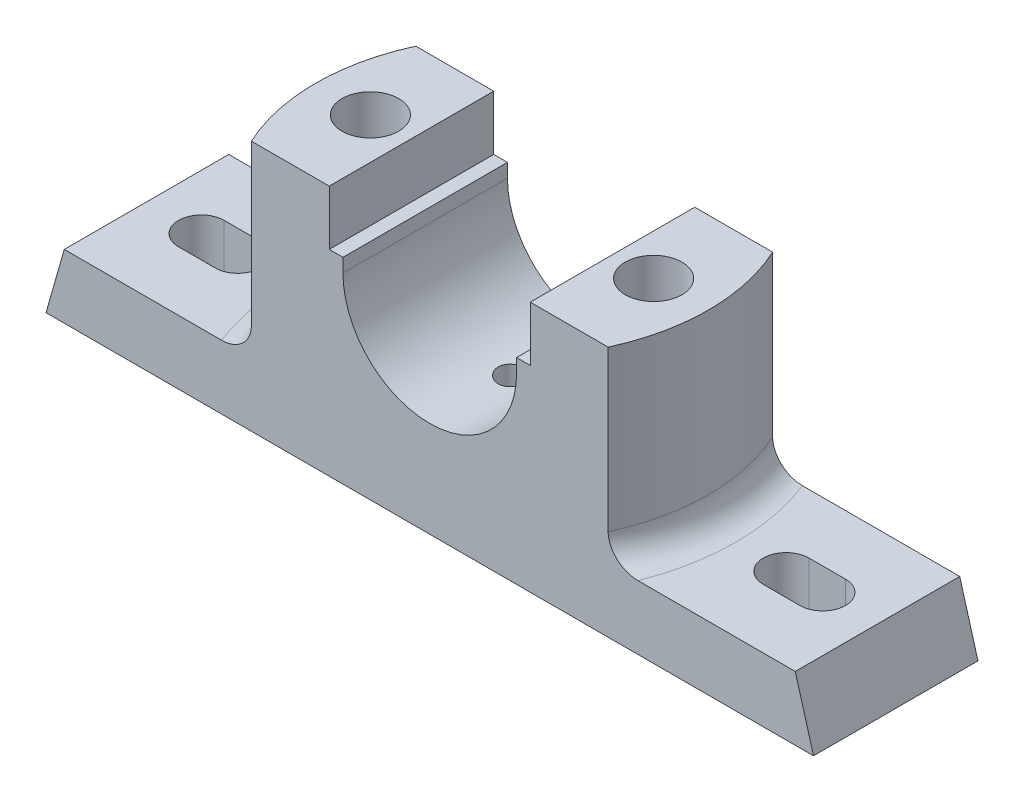
from build123d import *

# Parameters (mm, degrees)
BOSS_EXTRUDE1_DEPTH = 18
SKETCH2_W           = 68
SKETCH2_H           = 20
CUT_EXTRUDE1_DEPTH  = 2
FILLET1_R           = 2
SKETCH3_W           = 20
SKETCH3_H           = 20
CUT_EXTRUDE4_DEPTH  = 7
SKETCH6_R           = 6.203606153
CUT_EXTRUDE5_DEPTH  = 103.004901843
CUT_EXTRUDE6_START  = -41
CUT_EXTRUDE6_DEPTH  = 41
FILLET2_R           = 6


# Read off the part's stored shape, not the designer's step: Cut-Extrude6
with BuildPart() as part:
    # Sketch1 → Boss-Extrude1 (new, symmetric)
    with BuildSketch(Plane.XY):
        with BuildLine():
            Line((-84, 0), (84, 0))
            Line((84, 0), (80, 14))
            Line((80, 14), (43, 14))
            Line((43, 14), (43, 55))
            Line((43, 55), (22, 55))
            Line((22, 55), (22, 43))
            Line((22, 43), (19, 43))
            Line((19, 43), (19, 40))
            ThreePointArc((19, 40), (0, 21), (-19, 40))
            Line((-19, 40), (-19, 43))
            Line((-19, 43), (-22, 43))
            Line((-22, 43), (-22, 55))
            Line((-22, 55), (-43, 55))
            Line((-43, 55), (-43, 14))
            Line((-43, 14), (-80, 14))
            Line((-80, 14), (-84, 0))
        make_face()
    extrude(amount=BOSS_EXTRUDE1_DEPTH, both=True)

    # Sketch2 → Cut-Extrude1 (cut)
    with BuildSketch(Plane.XZ):
        with Locations((-42, 0)):
            Rectangle(SKETCH2_W, SKETCH2_H)
        with Locations((42, 0)):
            Rectangle(SKETCH2_W, SKETCH2_H)
    extrude(amount=-CUT_EXTRUDE1_DEPTH, mode=Mode.SUBTRACT)

    # Fillet1
    fillet1_edges = [part.edges().sort_by_distance(p)[0] for p in [
        (76, 2, 0),
        (8, 2, 0),
        (-8, 2, 0),
        (-76, 2, 0),
    ]]
    fillet(fillet1_edges, radius=FILLET1_R - 0.0001)  # a hair under: the kernel refuses the full size

    # Sketch3 → Cut-Extrude4 (cut)
    with BuildSketch(Plane.XZ):
        with Locations((-31, 0)):
            Rectangle(SKETCH3_W, SKETCH3_H)
        with Locations((31, 0)):
            Rectangle(SKETCH3_W, SKETCH3_H)
    extrude(amount=-CUT_EXTRUDE4_DEPTH, mode=Mode.SUBTRACT)

    # Sketch6 → Cut-Extrude5 (cut, through all)
    with BuildSketch(Plane.XZ):
        with Locations(Location((-31, 0, 0), (0, 0, 270))):
            Circle(SKETCH6_R)
        with Locations(Location((31, 0, 0), (0, 0, 90))):
            Circle(SKETCH6_R)
        with BuildLine():
            Line((-68, 5), (-60, 5))
            ThreePointArc((-60, 5), (-55, 0), (-60, -5))
            Line((-60, -5), (-68, -5))
            ThreePointArc((-68, -5), (-73, 0), (-68, 5))
        make_face()
        with BuildLine():
            Line((68, 5), (60, 5))
            ThreePointArc((60, 5), (55, 0), (60, -5))
            Line((60, -5), (68, -5))
            ThreePointArc((68, -5), (73, 0), (68, 5))
        make_face()
    extrude(amount=-CUT_EXTRUDE5_DEPTH, mode=Mode.SUBTRACT)

    # Cut-Extrude6 outline → Cut-Extrude6 (cut)
    with BuildSketch(Plane(origin=(0, 55, 0), x_dir=(1, 0, 0), z_dir=(0, 1, 0)).offset(CUT_EXTRUDE6_START)):
        with BuildLine():
            ThreePointArc((43, 0), (42.001212365, -9.214019744), (39.05124838, -18))
            Line((39.05124838, -18), (43, -18))
            Line((43, -18), (43, 0))
        make_face()
        with BuildLine():
            ThreePointArc((39.05124838, 18), (42.001212365, 9.214019744), (43, 0))
            Line((43, 0), (43, 18))
            Line((43, 18), (39.05124838, 18))
        make_face()
        with BuildLine():
            Line((-43, -18), (-39.05124838, -18))
            ThreePointArc((-39.05124838, -18), (-42.001212365, -9.214019744), (-43, 0))
            Line((-43, 0), (-43, -18))
        make_face()
        with BuildLine():
            Line((-43, 18), (-43, 0))
            ThreePointArc((-43, 0), (-42.001212365, 9.214019744), (-39.05124838, 18))
            Line((-39.05124838, 18), (-43, 18))
        make_face()
    extrude(amount=CUT_EXTRUDE6_DEPTH, mode=Mode.SUBTRACT)

    # Fillet2
    fillet2_edges = [part.edges().sort_by_distance(p)[0] for p in [
        (42.001212365, 14, -9.214019744),
        (-42.001212365, 14, 9.214019744),
    ]]
    fillet(fillet2_edges, radius=FILLET2_R)

    # Sketch8 → Cut-Revolve1 (revolve, cut)
    with BuildSketch(Plane.XY, mode=Mode.PRIVATE) as cut_revolve1_sk:
        Polygon((0, 21), (0, 13.435755104), (3, 15.238336961), (3, 21.238336961), align=None)
    revolve(cut_revolve1_sk.sketch.rotate(Axis((0, 21, 0), (0, -1, 0)), 180), axis=Axis((0, 21, 0), (0, -1, 0)), mode=Mode.SUBTRACT)


solid = part.part
